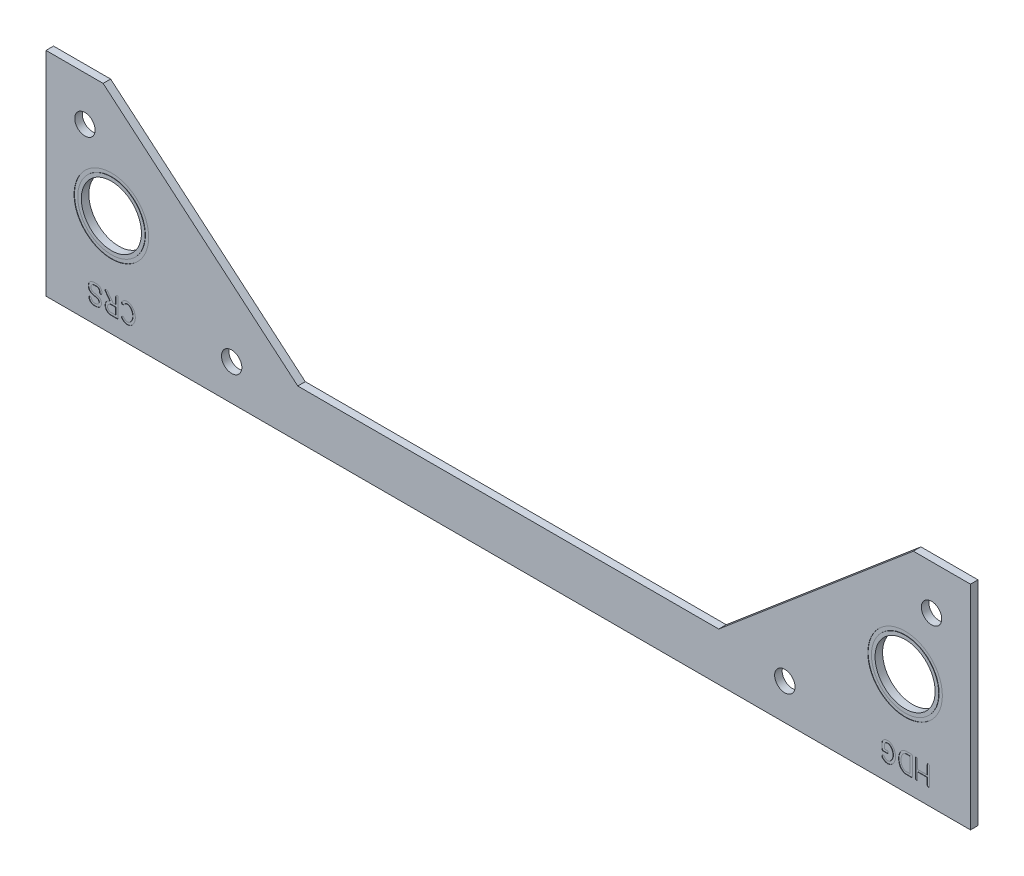
from build123d import *

# Parameters (mm, degrees)
SKETCH1_R             = 6.35
BOSS_EXTRUDE1_DEPTH   = 1.5875
F_6_CLEARANCE_HOLE1_D = 4.3053
WRAP1_START           = -0.0762
WRAP1_OUTLINE_R       = 7.874
WRAP1_OUTLINE_R_2     = 7.112
WRAP1_DEPTH           = 0.0762


# Read off the part's stored shape, not the designer's step: Wrap1
with BuildPart() as part:
    # Sketch1 → Boss-Extrude1 (new body)
    with BuildSketch(Plane.XY):
        Polygon((44.45, 10.16), (-44.45, 10.16), (-85.56625, 44.958), (-97.63125, 44.958), (-97.63125, 0), (97.63125, 0), (97.63125, 44.958), (85.56625, 44.958), align=None)
        with Locations((83.82, 21.59)):
            Circle(SKETCH1_R, mode=Mode.SUBTRACT)
        with Locations((-83.82, 21.59)):
            Circle(SKETCH1_R, mode=Mode.SUBTRACT)
    extrude(amount=BOSS_EXTRUDE1_DEPTH)

    # #6 Clearance Hole1 (through all)
    with Locations(Plane.XY.offset(1.5875)):
        with Locations((89.408, 35.56), (58.42, 7.62), (-58.42, 7.62), (-89.408, 35.56)):
            Hole(F_6_CLEARANCE_HOLE1_D / 2)

    # Wrap1 outline → Wrap1 (cut)
    # profile 1 of 8: a face of its own
    with BuildSketch(Plane.XY.offset(1.5875).offset(WRAP1_START)):
        with BuildLine():
            Line((88.493981083, 5.022523668), (88.493981083, 3.662843534))
            add(Edge.make_bspline(
                [(88.493981083, 3.662843534), (88.494987813, 3.639393258), (88.496867923, 3.595598926), (88.507456104, 3.534012781), (88.526617558, 3.481968162), (88.552883917, 3.43915638), (88.585909582, 3.404738694), (88.628294415, 3.383156015), (88.676480379, 3.368201286), (88.711228839, 3.367565991), (88.72952756, 3.367231442)],
                knots=[0, 0, 0, 0, 0.163145575, 0.304680914, 0.432746764, 0.546234711, 0.652222763, 0.75954351, 0.873374351, 1, 1, 1, 1], degree=3))
            add(Edge.make_bspline(
                [(88.72952756, 3.367231442), (88.755503069, 3.369576798), (88.804157081, 3.373969819), (88.868278836, 3.405621977), (88.91932179, 3.452839462), (88.937273236, 3.494979252), (88.946599804, 3.516872733)],
                knots=[0, 0, 0, 0, 0.27584322, 0.516674352, 0.748890989, 1, 1, 1, 1], degree=3))
            add(Edge.make_bspline(
                [(88.946599804, 3.516872733), (88.949336083, 3.5269797), (88.9546711, 3.546685598), (88.958302802, 3.579911349), (88.960092807, 3.622765923), (88.95974373, 3.655733197), (88.959531768, 3.675751142)],
                knots=[0, 0, 0, 0, 0.195990582, 0.382129514, 0.624824988, 1, 1, 1, 1], degree=3))
            Line((88.959531768, 3.675751142), (88.95953267, 7.324993192))
            add(Edge.make_bspline(
                [(88.95953267, 7.324993192), (88.95918669, 7.348233436), (88.958533812, 7.392088781), (88.94885352, 7.453762371), (88.930646455, 7.506258621), (88.904597811, 7.549320079), (88.870263693, 7.582154874), (88.827583902, 7.603849776), (88.777602822, 7.615788273), (88.741910974, 7.61612652), (88.723061579, 7.616305153)],
                knots=[0, 0, 0, 0, 0.160622086, 0.30310081, 0.42972381, 0.542581808, 0.648024553, 0.753746446, 0.869949841, 1, 1, 1, 1], degree=3))
            add(Edge.make_bspline(
                [(88.723061579, 7.616305153), (88.704820149, 7.616142616), (88.670327497, 7.615835274), (88.621934587, 7.603664824), (88.580405623, 7.582126109), (88.547041365, 7.549220773), (88.521901496, 7.506165239), (88.504911377, 7.453581951), (88.49486838, 7.391920949), (88.494289203, 7.347855101), (88.493981083, 7.324412264)],
                knots=[0, 0, 0, 0, 0.12736039, 0.240825295, 0.345955519, 0.451152037, 0.56428877, 0.691776822, 0.83602662, 1, 1, 1, 1], degree=3))
            Line((88.493981083, 7.324412264), (88.493981083, 5.488074353))
            Line((88.493981083, 5.488074353), (86.476596586, 5.488074353))
            Line((86.476596586, 5.488074353), (86.476596586, 7.299212254))
            add(Edge.make_bspline(
                [(86.476596586, 7.299212254), (86.476801176, 7.320855161), (86.477131076, 7.355754109), (86.475521057, 7.399943215), (86.471713125, 7.432252573), (86.466396058, 7.450709891), (86.463662818, 7.46019788)],
                knots=[0, 0, 0, 0, 0.40021474, 0.645341831, 0.817687883, 1, 1, 1, 1], degree=3))
            add(Edge.make_bspline(
                [(86.463662818, 7.46019788), (86.455717889, 7.482947411), (86.440375022, 7.526880215), (86.390430657, 7.57794996), (86.323355878, 7.608319445), (86.273407959, 7.613515406), (86.246590574, 7.616305153)],
                knots=[0, 0, 0, 0, 0.248391864, 0.479682481, 0.72063791, 1, 1, 1, 1], degree=3))
            add(Edge.make_bspline(
                [(86.246590574, 7.616305153), (86.22710955, 7.615848934), (86.190413113, 7.614989552), (86.139241692, 7.601967429), (86.096207612, 7.579781057), (86.061902862, 7.546551497), (86.037939661, 7.501994404), (86.021792625, 7.446691261), (86.01183918, 7.379882915), (86.011322452, 7.331225562), (86.011044097, 7.305014318)],
                knots=[0, 0, 0, 0, 0.128787138, 0.242596536, 0.346643283, 0.446192541, 0.553991865, 0.677886867, 0.826480782, 1, 1, 1, 1], degree=3))
            Line((86.011044097, 7.305014318), (86.011044999, 3.662843534))
            add(Edge.make_bspline(
                [(86.011044999, 3.662843534), (86.011335566, 3.639082207), (86.011878349, 3.594695789), (86.02198957, 3.532739659), (86.038915245, 3.480098796), (86.064372658, 3.437038609), (86.097355569, 3.403294735), (86.138896877, 3.380859229), (86.187253717, 3.367437418), (86.221863205, 3.367302585), (86.240124592, 3.367231442)],
                knots=[0, 0, 0, 0, 0.165306564, 0.308794471, 0.435609162, 0.548148335, 0.654294619, 0.759897952, 0.873312296, 1, 1, 1, 1], degree=3))
            add(Edge.make_bspline(
                [(86.240124592, 3.367231442), (86.258083995, 3.368390808), (86.292416785, 3.370607155), (86.341247792, 3.384951148), (86.384520164, 3.40836767), (86.421630892, 3.440743386), (86.450482096, 3.48098406), (86.470352855, 3.527219428), (86.479784749, 3.579656002), (86.477694193, 3.615996546), (86.476594781, 3.635107828)],
                knots=[0, 0, 0, 0, 0.132159831, 0.252648468, 0.371311252, 0.49177857, 0.611925638, 0.73275488, 0.859457334, 1, 1, 1, 1], degree=3))
            Line((86.476594781, 3.635107828), (86.476596586, 3.648886828))
            Line((86.476596586, 3.648886828), (86.476596586, 5.022523668))
            Line((86.476596586, 5.022523668), (88.493981083, 5.022523668))
        make_face()
    # profile 2 of 8: a face of its own
    with BuildSketch(Plane.XY.offset(1.5875).offset(WRAP1_START)):
        with BuildLine():
            Line((85.353361383, 3.697920222), (85.353362285, 7.230684394))
            add(Edge.make_bspline(
                [(85.353362285, 7.230684394), (85.3545604, 7.264093762), (85.356781915, 7.326040592), (85.347179224, 7.411307582), (85.327710237, 7.480685172), (85.296571398, 7.536192822), (85.248190749, 7.574600943), (85.187075686, 7.60167111), (85.110395914, 7.615402409), (85.054738858, 7.615987487), (85.024520026, 7.616305153)],
                knots=[0, 0, 0, 0, 0.165632283, 0.307111316, 0.423529841, 0.521468483, 0.616874736, 0.724163315, 0.850235297, 1, 1, 1, 1], degree=3))
            Line((85.024520026, 7.616305153), (84.123487997, 7.616305153))
            add(Edge.make_bspline(
                [(84.123487997, 7.616305153), (84.085723384, 7.615974995), (84.011450371, 7.61532566), (83.902187558, 7.604185509), (83.796477636, 7.589251531), (83.694536528, 7.566050622), (83.596513025, 7.535317044), (83.502178394, 7.49865168), (83.41198541, 7.454568656), (83.324812695, 7.404946699), (83.241467999, 7.347367278), (83.161698018, 7.282260052), (83.085295561, 7.209925308), (83.010388861, 7.131085021), (82.94011117, 7.04346273), (82.87241474, 6.948705427), (82.807523343, 6.847014503), (82.767819086, 6.775334411), (82.747570744, 6.738779061)],
                knots=[0, 0, 0, 0, 0.065536979, 0.128893921, 0.190512845, 0.250819081, 0.310169911, 0.368742757, 0.426366175, 0.48432095, 0.542747229, 0.602028193, 0.662919254, 0.725321696, 0.790696744, 0.857752969, 0.927456984, 1, 1, 1, 1], degree=3))
            add(Edge.make_bspline(
                [(82.747570744, 6.738779061), (82.72210879, 6.691143727), (82.67191226, 6.597233867), (82.612033876, 6.451618265), (82.561195258, 6.307296571), (82.52265572, 6.160244767), (82.494957674, 6.006094569), (82.475867814, 5.839812914), (82.464841435, 5.659113454), (82.464281367, 5.533659078), (82.463991259, 5.468675506)],
                knots=[0, 0, 0, 0, 0.122913588, 0.242315879, 0.35805373, 0.471138686, 0.588025999, 0.714382504, 0.852054224, 1, 1, 1, 1], degree=3))
            add(Edge.make_bspline(
                [(82.463991259, 5.468675506), (82.465302542, 5.380842764), (82.467844329, 5.210588137), (82.495523939, 4.963840057), (82.538470536, 4.733705836), (82.602766193, 4.520131218), (82.686402292, 4.32062847), (82.792245393, 4.134293881), (82.916207161, 3.956864888), (83.015326832, 3.851056116), (83.06532756, 3.797681083)],
                knots=[0, 0, 0, 0, 0.144255314, 0.279623914, 0.407417215, 0.52841464, 0.645397317, 0.76205245, 0.879967813, 1, 1, 1, 1], degree=3))
            add(Edge.make_bspline(
                [(83.06532756, 3.797681083), (83.101523538, 3.762631546), (83.172838141, 3.693575702), (83.291847306, 3.606042315), (83.415504087, 3.530170307), (83.547292261, 3.470106645), (83.684923978, 3.422837271), (83.829455975, 3.389539178), (83.980469551, 3.369686906), (84.083504755, 3.368059271), (84.135909393, 3.367231442)],
                knots=[0, 0, 0, 0, 0.127213436, 0.250640432, 0.372494573, 0.493323024, 0.61588337, 0.739719411, 0.867618933, 1, 1, 1, 1], degree=3))
            Line((84.135909393, 3.367231442), (85.011993089, 3.367232344))
            add(Edge.make_bspline(
                [(85.011993089, 3.367232344), (85.039625636, 3.367658373), (85.091740201, 3.368461857), (85.164699604, 3.381769992), (85.226661201, 3.406508191), (85.276739754, 3.443754895), (85.314435492, 3.49246366), (85.340766703, 3.551558899), (85.354373874, 3.621566259), (85.35371322, 3.671387492), (85.353361383, 3.697920222)],
                knots=[0, 0, 0, 0, 0.149708022, 0.282347061, 0.399882572, 0.508426231, 0.616661161, 0.730263632, 0.85634956, 1, 1, 1, 1], degree=3))
        make_face()
        with BuildLine():
            Line((84.828693151, 3.891901478), (84.117077041, 3.891901478))
            add(Edge.make_bspline(
                [(84.117077041, 3.891901478), (84.093176322, 3.89165555), (84.048314625, 3.891193943), (83.984658833, 3.894220744), (83.92856519, 3.898677046), (83.862794964, 3.906710463), (83.785567288, 3.927425549), (83.728786674, 3.954700322), (83.699917482, 3.968567743)],
                knots=[0, 0, 0, 0, 0.1670384, 0.313531406, 0.445256836, 0.560314845, 0.776449144, 1, 1, 1, 1], degree=3))
            add(Edge.make_bspline(
                [(83.699917482, 3.968567743), (83.668954285, 3.985033724), (83.605486619, 4.018785324), (83.517402269, 4.085592148), (83.431767476, 4.164095763), (83.34963399, 4.253553057), (83.273265842, 4.353262972), (83.204288354, 4.460241534), (83.142615016, 4.573510163), (83.108443691, 4.652751055), (83.091191487, 4.692757697)],
                knots=[0, 0, 0, 0, 0.10881488, 0.2230463, 0.342230135, 0.46952392, 0.599834168, 0.731985659, 0.864686609, 1, 1, 1, 1], degree=3))
            add(Edge.make_bspline(
                [(83.091191487, 4.692757697), (83.079636741, 4.720605978), (83.057065839, 4.775004474), (83.03209217, 4.856885852), (83.011634092, 4.935263395), (83.001330067, 5.000716287), (82.99649529, 5.056646032), (82.994080706, 5.106883182), (82.991049088, 5.165670968), (82.989319405, 5.233427944), (82.988713096, 5.310105324), (82.987482652, 5.395698718), (82.987600288, 5.490231637), (82.988295589, 5.556120763), (82.988659491, 5.590605447)],
                knots=[0, 0, 0, 0, 0.09913642, 0.193651885, 0.281364538, 0.365469695, 0.411235383, 0.466022875, 0.530927414, 0.604905703, 0.688992556, 0.783208964, 0.886537115, 1, 1, 1, 1], degree=3))
            add(Edge.make_bspline(
                [(82.988659491, 5.590605447), (82.988726823, 5.623242637), (82.988850689, 5.68328275), (82.988092813, 5.764585309), (82.990105475, 5.82926206), (82.993423481, 5.894427719), (83.003271336, 5.969957702), (83.018440053, 6.027977254), (83.02653167, 6.058927267)],
                knots=[0, 0, 0, 0, 0.207548397, 0.381810731, 0.516969731, 0.618955228, 0.796735068, 1, 1, 1, 1], degree=3))
            add(Edge.make_bspline(
                [(83.02653167, 6.058927267), (83.03686155, 6.100415597), (83.057387646, 6.182855417), (83.101264632, 6.301574505), (83.149335436, 6.417224511), (83.207976847, 6.526255311), (83.272179059, 6.630302097), (83.34415557, 6.725884788), (83.422081656, 6.813958311), (83.479282449, 6.866122114), (83.507785453, 6.892115199)],
                knots=[0, 0, 0, 0, 0.131076488, 0.260456909, 0.38784931, 0.515048918, 0.639818842, 0.76262785, 0.881718084, 1, 1, 1, 1], degree=3))
            add(Edge.make_bspline(
                [(83.507785453, 6.892115199), (83.528131017, 6.909399222), (83.568071818, 6.943329849), (83.631858033, 6.987441728), (83.699296598, 7.021478677), (83.769638204, 7.049251863), (83.846489459, 7.06801953), (83.930575585, 7.083539387), (84.024050728, 7.089753103), (84.089106719, 7.090991936), (84.12297743, 7.091636921)],
                knots=[0, 0, 0, 0, 0.12056717, 0.236687927, 0.349281488, 0.461125135, 0.577512149, 0.706024867, 0.846944969, 1, 1, 1, 1], degree=3))
            Line((84.12297743, 7.091636921), (84.828693151, 7.091636921))
            Line((84.828693151, 7.091636921), (84.828693151, 3.891901478))
        make_face(mode=Mode.SUBTRACT)
    # profile 3 of 8: a face of its own
    with BuildSketch(Plane.XY.offset(1.5875).offset(WRAP1_START)):
        with BuildLine():
            Line((79.441607556, 5.724544542), (79.441607556, 6.388713083))
            add(Edge.make_bspline(
                [(79.441607556, 6.388713083), (79.442031371, 6.428777651), (79.44279354, 6.500827914), (79.454733864, 6.600308769), (79.47603122, 6.685848735), (79.49930473, 6.736612908), (79.510885029, 6.761871853)],
                knots=[0, 0, 0, 0, 0.313430195, 0.56365834, 0.78288763, 1, 1, 1, 1], degree=3))
            add(Edge.make_bspline(
                [(79.510885029, 6.761871853), (79.525494122, 6.78705268), (79.55438024, 6.83684197), (79.611300463, 6.901603848), (79.675235667, 6.959065135), (79.748758044, 7.005485865), (79.828390303, 7.044209707), (79.914835027, 7.070263392), (80.006240231, 7.087599119), (80.069032759, 7.09027091), (80.101136791, 7.091636921)],
                knots=[0, 0, 0, 0, 0.122641954, 0.242496226, 0.362223526, 0.484465207, 0.608320686, 0.734962512, 0.864493876, 1, 1, 1, 1], degree=3))
            add(Edge.make_bspline(
                [(80.101136791, 7.091636921), (80.135374529, 7.090892778), (80.203300668, 7.089416431), (80.303139229, 7.073272506), (80.399709482, 7.046427647), (80.492207091, 7.007135189), (80.581784375, 6.957097046), (80.666750304, 6.894091569), (80.749578143, 6.821627503), (80.7991323, 6.765536111), (80.824403033, 6.736931637)],
                knots=[0, 0, 0, 0, 0.123087433, 0.244199952, 0.362736785, 0.482887978, 0.604903977, 0.730980946, 0.862810527, 1, 1, 1, 1], degree=3))
            add(Edge.make_bspline(
                [(80.824403033, 6.736931637), (80.85838663, 6.693433293), (80.926724831, 6.60596172), (81.01676944, 6.463779202), (81.093921113, 6.310876278), (81.159878408, 6.150250789), (81.213608385, 5.985509826), (81.250995257, 5.819057458), (81.276717382, 5.653285672), (81.280004363, 5.542358725), (81.281640313, 5.487149739)],
                knots=[0, 0, 0, 0, 0.122105124, 0.245543303, 0.371702871, 0.500643429, 0.629502944, 0.754629679, 0.877877766, 1, 1, 1, 1], degree=3))
            add(Edge.make_bspline(
                [(81.281640313, 5.487149739), (81.280502322, 5.44184457), (81.278227393, 5.351276114), (81.262106091, 5.216611997), (81.236058141, 5.08357133), (81.200306423, 4.953240623), (81.155097084, 4.827003388), (81.101528874, 4.705858504), (81.037692122, 4.591115059), (80.988460005, 4.519049856), (80.963883496, 4.483075147)],
                knots=[0, 0, 0, 0, 0.127017124, 0.253916831, 0.379719298, 0.506853733, 0.632469429, 0.755367784, 0.877880415, 1, 1, 1, 1], degree=3))
            add(Edge.make_bspline(
                [(80.963883496, 4.483075147), (80.934581712, 4.436291683), (80.878156042, 4.346202008), (80.782472646, 4.225484568), (80.682571517, 4.12278701), (80.577511211, 4.038220333), (80.466944329, 3.973044888), (80.351662929, 3.925906669), (80.23124935, 3.897115622), (80.149016593, 3.893646688), (80.107602772, 3.891899674)],
                knots=[0, 0, 0, 0, 0.15167662, 0.292079647, 0.42257614, 0.544865842, 0.661738228, 0.774134759, 0.88625041, 1, 1, 1, 1], degree=3))
            add(Edge.make_bspline(
                [(80.107602772, 3.891899674), (80.076720375, 3.892850809), (80.015670053, 3.894731075), (79.925915392, 3.913271685), (79.839405069, 3.942360749), (79.756449221, 3.986456473), (79.675246899, 4.043970601), (79.594370683, 4.11564091), (79.512197625, 4.201065032), (79.461631809, 4.26610577), (79.435140672, 4.300180235)],
                knots=[0, 0, 0, 0, 0.113034475, 0.223453864, 0.334425296, 0.446464253, 0.566352764, 0.698288518, 0.841935104, 1, 1, 1, 1], degree=3))
            add(Edge.make_bspline(
                [(79.435140672, 4.300180235), (79.421702088, 4.317509051), (79.396617702, 4.349854923), (79.360348089, 4.393342611), (79.32695761, 4.427116503), (79.288376648, 4.459003012), (79.238031373, 4.486827928), (79.194436601, 4.489258757), (79.172806556, 4.49046484)],
                knots=[0, 0, 0, 0, 0.194944981, 0.363883205, 0.503243782, 0.616105563, 0.809526383, 1, 1, 1, 1], degree=3))
            add(Edge.make_bspline(
                [(79.172806556, 4.49046484), (79.155392688, 4.488805282), (79.121225042, 4.485549071), (79.072619139, 4.4666167), (79.02777616, 4.438812721), (78.988399128, 4.400634148), (78.955744376, 4.355757467), (78.929727229, 4.306300528), (78.915047181, 4.251394619), (78.91202363, 4.213430398), (78.91047244, 4.193953392)],
                knots=[0, 0, 0, 0, 0.120141663, 0.235729244, 0.355945972, 0.482130469, 0.611265293, 0.737592694, 0.865375651, 1, 1, 1, 1], degree=3))
            add(Edge.make_bspline(
                [(78.91047244, 4.193953392), (78.91226134, 4.168148121), (78.915973704, 4.114596452), (78.94235804, 4.049437956), (78.974391934, 3.996137608), (79.006637263, 3.950783862), (79.045953623, 3.900133387), (79.075636218, 3.865887256), (79.091519928, 3.847561513)],
                knots=[0, 0, 0, 0, 0.193167382, 0.40086521, 0.518955138, 0.659977964, 0.818047872, 1, 1, 1, 1], degree=3))
            add(Edge.make_bspline(
                [(79.091519928, 3.847561513), (79.129953932, 3.809265341), (79.204858319, 3.734629576), (79.326079512, 3.637260768), (79.450297599, 3.553973257), (79.578778103, 3.486879452), (79.710311627, 3.433004164), (79.845786437, 3.395466254), (79.98480068, 3.371190004), (80.078867811, 3.368554243), (80.126077006, 3.367231442)],
                knots=[0, 0, 0, 0, 0.138655538, 0.270227067, 0.396882054, 0.5204978, 0.640241631, 0.759640695, 0.879371582, 1, 1, 1, 1], degree=3))
            add(Edge.make_bspline(
                [(80.126077006, 3.367231442), (80.161535569, 3.368104813), (80.233024783, 3.369865648), (80.339430415, 3.384702861), (80.446135679, 3.405595721), (80.551263056, 3.436249856), (80.654103263, 3.473737753), (80.752559768, 3.518011995), (80.845425639, 3.569920969), (80.903512691, 3.609720076), (80.932477299, 3.629565558)],
                knots=[0, 0, 0, 0, 0.123474493, 0.248941123, 0.373690374, 0.502026764, 0.629963554, 0.754781963, 0.877724135, 1, 1, 1, 1], degree=3))
            add(Edge.make_bspline(
                [(80.932477299, 3.629565558), (80.965479307, 3.656550786), (81.031706519, 3.710703749), (81.124561191, 3.799621057), (81.212553366, 3.8939167), (81.294866423, 3.993905849), (81.371675256, 4.09939238), (81.4429958, 4.210870879), (81.509430404, 4.327972027), (81.570106178, 4.450426834), (81.62434745, 4.576247924), (81.671298862, 4.704067489), (81.71242493, 4.832706176), (81.745725895, 4.963178871), (81.771249116, 5.095273966), (81.790969472, 5.228672029), (81.803238342, 5.363454897), (81.805283966, 5.453871553), (81.806308545, 5.499157991)],
                knots=[0, 0, 0, 0, 0.059978086, 0.120361813, 0.180764197, 0.241408588, 0.302515685, 0.364301227, 0.427564425, 0.491904847, 0.556543732, 0.620297763, 0.683477795, 0.746538826, 0.809683181, 0.872744213, 0.936262171, 1, 1, 1, 1], degree=3))
            add(Edge.make_bspline(
                [(81.806308545, 5.499157991), (81.804328977, 5.565740667), (81.800365654, 5.699046851), (81.774586015, 5.89766311), (81.733908465, 6.094770501), (81.676963421, 6.288881673), (81.603712423, 6.477506168), (81.518194396, 6.659411286), (81.417061878, 6.832343482), (81.339177898, 6.940433672), (81.300114547, 6.994647195)],
                knots=[0, 0, 0, 0, 0.124376918, 0.24901691, 0.373558647, 0.500057536, 0.626426892, 0.751214123, 0.875219398, 1, 1, 1, 1], degree=3))
            add(Edge.make_bspline(
                [(81.300114547, 6.994647195), (81.259879703, 7.044215716), (81.181598949, 7.140656035), (81.049740173, 7.266771355), (80.913030859, 7.3746917), (80.77020469, 7.46355428), (80.620651093, 7.531416978), (80.465816163, 7.580986396), (80.304214517, 7.61016805), (80.194547688, 7.614241985), (80.139008969, 7.616305153)],
                knots=[0, 0, 0, 0, 0.140053996, 0.272488503, 0.399610813, 0.521934798, 0.64082569, 0.759271769, 0.878087681, 1, 1, 1, 1], degree=3))
            add(Edge.make_bspline(
                [(80.139008969, 7.616305153), (80.085289444, 7.614318934), (79.978932249, 7.610386496), (79.822373902, 7.579864438), (79.670024768, 7.535097878), (79.524046751, 7.472137145), (79.3871071, 7.395516193), (79.263001183, 7.305102848), (79.152546827, 7.202454289), (79.090873595, 7.124200464), (79.060113731, 7.085170939)],
                knots=[0, 0, 0, 0, 0.129324271, 0.256044085, 0.383006815, 0.511280207, 0.638156234, 0.760261192, 0.880428952, 1, 1, 1, 1], degree=3))
            add(Edge.make_bspline(
                [(79.060113731, 7.085170939), (79.036168422, 7.046504351), (78.989703737, 6.971473751), (78.952423853, 6.867354841), (78.931961052, 6.781889537), (78.923937471, 6.711819105), (78.916353004, 6.636099594), (78.916738254, 6.583311599), (78.916938421, 6.555884149)],
                knots=[0, 0, 0, 0, 0.244071475, 0.473608612, 0.590930531, 0.716257593, 0.852573848, 1, 1, 1, 1], degree=3))
            Line((78.916938421, 6.555884149), (78.916939323, 5.555905821))
            add(Edge.make_bspline(
                [(78.916939323, 5.555905821), (78.916732912, 5.524954475), (78.916351846, 5.467813506), (78.92750903, 5.388735811), (78.950244803, 5.324210847), (78.984517162, 5.272381751), (79.034430157, 5.235964666), (79.097127433, 5.211092222), (79.174211573, 5.199138098), (79.2297399, 5.199617373), (79.259635453, 5.199875408)],
                knots=[0, 0, 0, 0, 0.158079594, 0.291839362, 0.405849866, 0.505375872, 0.60420274, 0.716418036, 0.847324058, 1, 1, 1, 1], degree=3))
            Line((79.259635453, 5.199875408), (79.879372019, 5.199875408))
            add(Edge.make_bspline(
                [(79.879372019, 5.199875408), (79.907106962, 5.199981711), (79.953662498, 5.200160151), (80.013453799, 5.20257746), (80.055941539, 5.210884443), (80.078157208, 5.220477095), (80.088204827, 5.224815623)],
                knots=[0, 0, 0, 0, 0.392293409, 0.658498923, 0.845547188, 1, 1, 1, 1], degree=3))
            add(Edge.make_bspline(
                [(80.088204827, 5.224815623), (80.11198587, 5.236346232), (80.159100311, 5.259190403), (80.21175832, 5.317742782), (80.247120396, 5.386677274), (80.251418543, 5.437176227), (80.253549217, 5.462209524)],
                knots=[0, 0, 0, 0, 0.256473684, 0.508119618, 0.756165489, 1, 1, 1, 1], degree=3))
            add(Edge.make_bspline(
                [(80.253549217, 5.462209524), (80.251366188, 5.484527668), (80.247140792, 5.527725909), (80.226076825, 5.588906945), (80.188310253, 5.640306266), (80.155667918, 5.666723499), (80.139008969, 5.680205479)],
                knots=[0, 0, 0, 0, 0.262673653, 0.508422212, 0.749124281, 1, 1, 1, 1], degree=3))
            add(Edge.make_bspline(
                [(80.139008969, 5.680205479), (80.127086056, 5.688690808), (80.10252488, 5.706170568), (80.063748054, 5.715942758), (80.027950546, 5.720324413), (79.99311683, 5.723360692), (79.95118288, 5.723503384), (79.920703178, 5.724180925), (79.904386204, 5.72454364)],
                knots=[0, 0, 0, 0, 0.178960546, 0.368658346, 0.483484291, 0.624321334, 0.798884543, 1, 1, 1, 1], degree=3))
            Line((79.904386204, 5.72454364), (79.441607556, 5.724544542))
        make_face()
    # profile 4 of 8: a face of its own
    with BuildSketch(Plane.XY.offset(1.5875).offset(WRAP1_START)):
        with BuildLine():
            add(Edge.make_bspline(
                [(-87.018826164, 3.387266243), (-86.979937425, 3.390357765), (-86.90327483, 3.39645218), (-86.791263591, 3.417546896), (-86.683923457, 3.445261436), (-86.583055125, 3.484103803), (-86.486584576, 3.528707351), (-86.397480337, 3.585047439), (-86.31234676, 3.647775462), (-86.234597246, 3.719830562), (-86.163275582, 3.797935011), (-86.101275095, 3.882297836), (-86.04832516, 3.971816985), (-86.00351442, 4.065846545), (-85.969870417, 4.165609838), (-85.943246849, 4.269504952), (-85.927986555, 4.378891267), (-85.924261399, 4.453475072), (-85.922367776, 4.491388552)],
                knots=[0, 0, 0, 0, 0.067837627, 0.133730448, 0.198062568, 0.260457926, 0.321570286, 0.382680298, 0.443545548, 0.505356171, 0.566805809, 0.627351865, 0.687170508, 0.747569405, 0.808229145, 0.870083873, 0.933959222, 1, 1, 1, 1], degree=3))
            add(Edge.make_bspline(
                [(-85.922367776, 4.491388552), (-85.924421734, 4.536439583), (-85.928515649, 4.626234523), (-85.952909748, 4.758796905), (-85.993275021, 4.887196785), (-86.047233938, 5.010511322), (-86.115290428, 5.125543269), (-86.195333251, 5.229636378), (-86.28583383, 5.322981388), (-86.355695524, 5.373279062), (-86.390689596, 5.398473418)],
                knots=[0, 0, 0, 0, 0.127450784, 0.254032707, 0.379917634, 0.50743089, 0.633940888, 0.75692129, 0.878240662, 1, 1, 1, 1], degree=3))
            add(Edge.make_bspline(
                [(-86.390689596, 5.398473418), (-86.421854114, 5.419184491), (-86.487306297, 5.462682193), (-86.601839713, 5.510237407), (-86.730772931, 5.55411839), (-86.823928396, 5.573194321), (-86.872867091, 5.583215753)],
                knots=[0, 0, 0, 0, 0.215334226, 0.45224813, 0.712241667, 1, 1, 1, 1], degree=3))
            Line((-86.872867091, 5.583215753), (-87.558850201, 5.730486426))
            add(Edge.make_bspline(
                [(-87.558850201, 5.730486426), (-87.584003321, 5.735166474), (-87.631129061, 5.7439348), (-87.695821328, 5.76247474), (-87.752000153, 5.778817796), (-87.784999745, 5.793494761), (-87.800273614, 5.800287997)],
                knots=[0, 0, 0, 0, 0.304444496, 0.570393348, 0.801156462, 1, 1, 1, 1], degree=3))
            add(Edge.make_bspline(
                [(-87.800273614, 5.800287997), (-87.826984665, 5.815503736), (-87.88015811, 5.845793567), (-87.950440175, 5.905527165), (-88.014058986, 5.973208492), (-88.06841503, 6.050538256), (-88.111184424, 6.135504153), (-88.144268008, 6.224508686), (-88.164039932, 6.31795031), (-88.167225426, 6.381520296), (-88.168834573, 6.413632551)],
                knots=[0, 0, 0, 0, 0.12260065, 0.244059996, 0.36680873, 0.493107322, 0.620218362, 0.745940299, 0.871662237, 1, 1, 1, 1], degree=3))
            add(Edge.make_bspline(
                [(-88.168834573, 6.413632551), (-88.166267428, 6.45256707), (-88.161216042, 6.529178747), (-88.134252383, 6.640599004), (-88.088704472, 6.74416317), (-88.029392818, 6.840028119), (-87.955632504, 6.923953127), (-87.871270524, 6.992979275), (-87.776766846, 7.045729784), (-87.708387218, 7.066386502), (-87.673725114, 7.076857534)],
                knots=[0, 0, 0, 0, 0.131496622, 0.25874666, 0.38438763, 0.511802964, 0.637684246, 0.759539767, 0.878109054, 1, 1, 1, 1], degree=3))
            add(Edge.make_bspline(
                [(-87.673725114, 7.076857534), (-87.654662643, 7.080139701), (-87.611164078, 7.087629263), (-87.542007005, 7.094424606), (-87.472173622, 7.101501572), (-87.426800192, 7.102347896), (-87.40677244, 7.102721461)],
                knots=[0, 0, 0, 0, 0.21608302, 0.493078829, 0.776245885, 1, 1, 1, 1], degree=3))
            Line((-87.40677244, 7.102721461), (-87.025179388, 7.103217595))
            add(Edge.make_bspline(
                [(-87.025179388, 7.103217595), (-86.998723677, 7.103003017), (-86.948812146, 7.102598191), (-86.878832313, 7.098148596), (-86.818111412, 7.090573619), (-86.781659925, 7.081196557), (-86.764792825, 7.076857534)],
                knots=[0, 0, 0, 0, 0.302265188, 0.570255645, 0.801145532, 1, 1, 1, 1], degree=3))
            add(Edge.make_bspline(
                [(-86.764792825, 7.076857534), (-86.73510887, 7.065794102), (-86.675978345, 7.043755714), (-86.594500779, 6.993509452), (-86.521378559, 6.929870261), (-86.456364365, 6.855642556), (-86.402031478, 6.773472199), (-86.362035754, 6.685911824), (-86.335799234, 6.595209145), (-86.331133034, 6.533266966), (-86.328800913, 6.502308871)],
                knots=[0, 0, 0, 0, 0.123908275, 0.246825646, 0.372593975, 0.502557912, 0.632404176, 0.757126356, 0.878614129, 1, 1, 1, 1], degree=3))
            add(Edge.make_bspline(
                [(-86.328800913, 6.502308871), (-86.329018383, 6.496142092), (-86.329696601, 6.476909919), (-86.333013534, 6.45793165), (-86.335266895, 6.445038748)],
                knots=[0, 0, 0, 0, 0.320649132, 1, 1, 1, 1], degree=3))
            Line((-86.335266895, 6.445038748), (-86.33519022, 6.394505224))
            add(Edge.make_bspline(
                [(-86.33519022, 6.394505224), (-86.333987325, 6.375551242), (-86.331694692, 6.339426272), (-86.318385661, 6.287540011), (-86.29637017, 6.241208903), (-86.265538824, 6.201220901), (-86.228391683, 6.168728083), (-86.186222583, 6.144120817), (-86.138911255, 6.128773218), (-86.105684893, 6.126566706), (-86.088635877, 6.125434508)],
                knots=[0, 0, 0, 0, 0.139958053, 0.266750316, 0.392807071, 0.516003708, 0.63680795, 0.754931163, 0.874250976, 1, 1, 1, 1], degree=3))
            add(Edge.make_bspline(
                [(-86.088635877, 6.125434508), (-86.06814493, 6.12697077), (-86.028061234, 6.129975954), (-85.971859267, 6.150084971), (-85.921787138, 6.181411967), (-85.880317485, 6.22565813), (-85.847269952, 6.280000425), (-85.822086186, 6.342284718), (-85.807312439, 6.413271662), (-85.805229161, 6.463133436), (-85.804132681, 6.489376908)],
                knots=[0, 0, 0, 0, 0.118909284, 0.232606296, 0.342759225, 0.459139682, 0.581234599, 0.71043286, 0.847593726, 1, 1, 1, 1], degree=3))
            add(Edge.make_bspline(
                [(-85.804132681, 6.489376908), (-85.807104145, 6.545614345), (-85.812961229, 6.656464581), (-85.850400232, 6.818638032), (-85.909737941, 6.97293058), (-85.991279481, 7.117416804), (-86.090594119, 7.249873767), (-86.207408015, 7.365011192), (-86.340564515, 7.461372495), (-86.438838558, 7.509035357), (-86.488603033, 7.533171102)],
                knots=[0, 0, 0, 0, 0.127880462, 0.252066598, 0.376650913, 0.502685102, 0.6281734, 0.751967999, 0.874400382, 1, 1, 1, 1], degree=3))
            add(Edge.make_bspline(
                [(-86.488603033, 7.533171102), (-86.528136859, 7.545296819), (-86.610596414, 7.570588609), (-86.741595303, 7.594850844), (-86.879201675, 7.612034248), (-86.97288261, 7.614881231), (-87.019737247, 7.616305153)],
                knots=[0, 0, 0, 0, 0.229738997, 0.479189018, 0.739515731, 1, 1, 1, 1], degree=3))
            Line((-87.019737247, 7.616305153), (-87.434150929, 7.616305153))
            add(Edge.make_bspline(
                [(-87.434150929, 7.616305153), (-87.479880987, 7.614208399), (-87.569384715, 7.610104592), (-87.700004166, 7.592695094), (-87.82344137, 7.564577785), (-87.940867418, 7.528307034), (-88.05057505, 7.479322931), (-88.15497325, 7.423548089), (-88.251608782, 7.356203334), (-88.34097254, 7.279715174), (-88.421847072, 7.195317453), (-88.493028885, 7.103861751), (-88.553002949, 7.005902574), (-88.602499009, 6.901214688), (-88.641193909, 6.789980833), (-88.669602958, 6.672109541), (-88.688743935, 6.547864362), (-88.691894719, 6.462660731), (-88.693502805, 6.419174821)],
                knots=[0, 0, 0, 0, 0.070604379, 0.138188217, 0.202953782, 0.265750532, 0.327439757, 0.388021697, 0.448108091, 0.508751457, 0.569227151, 0.628137868, 0.687203511, 0.746062496, 0.806456047, 0.868555415, 0.932913804, 1, 1, 1, 1], degree=3))
            add(Edge.make_bspline(
                [(-88.693502805, 6.419174821), (-88.692256959, 6.38157034), (-88.689797885, 6.307345882), (-88.675760425, 6.198252196), (-88.653350501, 6.093681836), (-88.624228969, 5.992845543), (-88.584625858, 5.896930734), (-88.539051772, 5.803782807), (-88.482925929, 5.716314986), (-88.420359514, 5.632839313), (-88.350025665, 5.555726035), (-88.274356981, 5.483910034), (-88.191389323, 5.420122418), (-88.102849968, 5.362709192), (-88.007990322, 5.312966583), (-87.907893906, 5.269089041), (-87.801426518, 5.233182701), (-87.72774796, 5.214765466), (-87.690351924, 5.205417678)],
                knots=[0, 0, 0, 0, 0.065995967, 0.130264126, 0.1926796, 0.253539267, 0.314139362, 0.374546463, 0.435254847, 0.496200792, 0.557404842, 0.61818051, 0.679025785, 0.74077118, 0.803128164, 0.866766407, 0.932376416, 1, 1, 1, 1], degree=3))
            Line((-87.690351924, 5.205417678), (-86.99967809, 5.064497523))
            add(Edge.make_bspline(
                [(-86.99967809, 5.064497523), (-86.977130912, 5.059365813), (-86.934264912, 5.049609565), (-86.873940225, 5.03699303), (-86.822321004, 5.021779435), (-86.791234872, 5.010932407), (-86.776801076, 5.005895956)],
                knots=[0, 0, 0, 0, 0.300763043, 0.571801407, 0.801180451, 1, 1, 1, 1], degree=3))
            add(Edge.make_bspline(
                [(-86.776801076, 5.005895956), (-86.752620573, 4.994055807), (-86.704879166, 4.970678901), (-86.641508446, 4.92183417), (-86.584186016, 4.86554503), (-86.536888336, 4.798776411), (-86.497951549, 4.725848057), (-86.469224006, 4.647904455), (-86.450878626, 4.565196242), (-86.448336343, 4.508420268), (-86.447036008, 4.4793803)],
                knots=[0, 0, 0, 0, 0.12276062, 0.242375628, 0.363773641, 0.488756426, 0.614662712, 0.740663334, 0.867353602, 1, 1, 1, 1], degree=3))
            add(Edge.make_bspline(
                [(-86.447036008, 4.4793803), (-86.44941188, 4.438796659), (-86.454009097, 4.360268967), (-86.487685775, 4.24874366), (-86.540611071, 4.148763904), (-86.614982276, 4.063832355), (-86.703932894, 3.992454583), (-86.808991724, 3.940653283), (-86.926818815, 3.905592003), (-87.010554378, 3.898396702), (-87.053914579, 3.894670809)],
                knots=[0, 0, 0, 0, 0.129639345, 0.250846854, 0.36936826, 0.488786334, 0.609364127, 0.731797594, 0.861118621, 1, 1, 1, 1], degree=3))
            Line((-87.053914579, 3.894670809), (-87.372831448, 3.888981503))
            Line((-87.372831448, 3.888981503), (-87.404755429, 3.888981503))
            add(Edge.make_bspline(
                [(-87.404755429, 3.888981503), (-87.44716494, 3.889966605), (-87.528503191, 3.891855957), (-87.643514844, 3.918982956), (-87.746657588, 3.959963921), (-87.835708845, 4.0205008), (-87.912024696, 4.097067742), (-87.975383259, 4.189909538), (-88.024719531, 4.299835159), (-88.045358791, 4.380149854), (-88.056141748, 4.422110176)],
                knots=[0, 0, 0, 0, 0.137472234, 0.263661397, 0.381624758, 0.496210213, 0.610800035, 0.730944547, 0.859432283, 1, 1, 1, 1], degree=3))
            add(Edge.make_bspline(
                [(-88.056141748, 4.422110176), (-88.061886494, 4.440119673), (-88.072824489, 4.474409752), (-88.094817289, 4.520932735), (-88.12121619, 4.559975155), (-88.151369353, 4.59153458), (-88.186014118, 4.615477347), (-88.224356609, 4.632655108), (-88.267338822, 4.64071376), (-88.296899807, 4.640311663), (-88.312009883, 4.640106132)],
                knots=[0, 0, 0, 0, 0.154020825, 0.293255627, 0.417897251, 0.536846803, 0.646878629, 0.759290409, 0.876961469, 1, 1, 1, 1], degree=3))
            add(Edge.make_bspline(
                [(-88.312009883, 4.640106132), (-88.330593223, 4.638992178), (-88.366533714, 4.636837772), (-88.417500429, 4.621591795), (-88.462899553, 4.597180969), (-88.501696475, 4.56359719), (-88.533743135, 4.522731753), (-88.555687139, 4.474506298), (-88.56996994, 4.42105882), (-88.572243237, 4.383409901), (-88.573420287, 4.363916341)],
                knots=[0, 0, 0, 0, 0.130879693, 0.253123515, 0.371609903, 0.49167618, 0.612368621, 0.734708751, 0.862639586, 1, 1, 1, 1], degree=3))
            add(Edge.make_bspline(
                [(-88.573420287, 4.363916341), (-88.57110586, 4.330489954), (-88.566102461, 4.258227751), (-88.534486008, 4.148047199), (-88.489621425, 4.032397724), (-88.447821867, 3.9582622), (-88.42655013, 3.920534736)],
                knots=[0, 0, 0, 0, 0.212562519, 0.459524264, 0.724952661, 1, 1, 1, 1], degree=3))
            add(Edge.make_bspline(
                [(-88.42655013, 3.920534736), (-88.399329979, 3.877854438), (-88.345800474, 3.793921942), (-88.247366383, 3.683303229), (-88.137355782, 3.588047709), (-88.016347524, 3.508903837), (-87.887317878, 3.445727474), (-87.751938685, 3.401763543), (-87.612182801, 3.372230845), (-87.516845846, 3.368909898), (-87.468661122, 3.367231442)],
                knots=[0, 0, 0, 0, 0.1310157, 0.257647564, 0.382103783, 0.507144384, 0.631334298, 0.753208409, 0.875267836, 1, 1, 1, 1], degree=3))
            Line((-87.468661122, 3.367231442), (-87.430294613, 3.367232344))
            Line((-87.430294613, 3.367232344), (-87.018826164, 3.387266243))
        make_face()
    # profile 5 of 8: a face of its own
    with BuildSketch(Plane.XY.offset(1.5875).offset(WRAP1_START)):
        with BuildLine():
            add(Edge.make_bspline(
                [(-84.115025752, 5.824042001), (-84.153528106, 5.815746459), (-84.229176381, 5.799447627), (-84.338470759, 5.766071617), (-84.441398485, 5.725428969), (-84.538354255, 5.67723921), (-84.628968267, 5.620522139), (-84.714190694, 5.556838754), (-84.793345485, 5.485360644), (-84.864874155, 5.406014811), (-84.92943721, 5.320842796), (-84.987455829, 5.231266451), (-85.035222316, 5.135995968), (-85.074195628, 5.035949109), (-85.105647264, 4.931602116), (-85.128854424, 4.822281102), (-85.142740842, 4.708195084), (-85.145199839, 4.630598645), (-85.146449967, 4.591149413)],
                knots=[0, 0, 0, 0, 0.067306555, 0.132241911, 0.195089406, 0.25629093, 0.317049495, 0.377579643, 0.437947091, 0.499058014, 0.559905429, 0.620499621, 0.681230821, 0.741733501, 0.803844927, 0.867332755, 0.932553336, 1, 1, 1, 1], degree=3))
            add(Edge.make_bspline(
                [(-85.146449967, 4.591149413), (-85.144446423, 4.546439955), (-85.140533483, 4.459122004), (-85.121846394, 4.331670152), (-85.092482237, 4.210908193), (-85.051432389, 4.09690624), (-85.000914751, 3.989043881), (-84.938277249, 3.888562309), (-84.864895821, 3.794723079), (-84.780906386, 3.708491638), (-84.688764018, 3.629762873), (-84.588411521, 3.561088373), (-84.480887446, 3.502845793), (-84.366693709, 3.454791203), (-84.245647462, 3.416191576), (-84.116993234, 3.390555782), (-83.981846688, 3.372154749), (-83.88934181, 3.368894169), (-83.84216908, 3.367231442)],
                knots=[0, 0, 0, 0, 0.066972661, 0.130798174, 0.192516203, 0.252737171, 0.311918725, 0.370508413, 0.429619903, 0.489932553, 0.550435175, 0.610788332, 0.67164119, 0.73320235, 0.79604133, 0.861499127, 0.929371679, 1, 1, 1, 1], degree=3))
            Line((-83.84216908, 3.367231442), (-82.760934795, 3.367232344))
            add(Edge.make_bspline(
                [(-82.760934795, 3.367232344), (-82.72901578, 3.366776263), (-82.669206005, 3.365921661), (-82.585786153, 3.380630567), (-82.514985618, 3.40710624), (-82.457332138, 3.447681633), (-82.414557827, 3.502431885), (-82.386534331, 3.569620996), (-82.373312682, 3.648759288), (-82.374619621, 3.704965764), (-82.375314938, 3.734868689)],
                knots=[0, 0, 0, 0, 0.152562747, 0.285871711, 0.403042079, 0.511865096, 0.618926373, 0.731199638, 0.856993042, 1, 1, 1, 1], degree=3))
            Line((-82.375314938, 3.734868689), (-82.375314036, 7.246272029))
            add(Edge.make_bspline(
                [(-82.375314036, 7.246272029), (-82.375186005, 7.271708337), (-82.374978903, 7.31285408), (-82.375977219, 7.364128847), (-82.37717644, 7.397864322), (-82.380388076, 7.415570488), (-82.38178092, 7.423249413)],
                knots=[0, 0, 0, 0, 0.430215932, 0.695916786, 0.868123225, 1, 1, 1, 1], degree=3))
            add(Edge.make_bspline(
                [(-82.38178092, 7.423249413), (-82.385169399, 7.437331598), (-82.391826073, 7.464996081), (-82.412418842, 7.502449729), (-82.437969585, 7.536243546), (-82.471277494, 7.563939116), (-82.508571464, 7.586822361), (-82.550023825, 7.603748445), (-82.594658762, 7.614073981), (-82.625585832, 7.615552045), (-82.641343901, 7.616305153)],
                knots=[0, 0, 0, 0, 0.123366308, 0.242353374, 0.36247188, 0.483882792, 0.610358729, 0.735566843, 0.865265096, 1, 1, 1, 1], degree=3))
            add(Edge.make_bspline(
                [(-82.641343901, 7.616305153), (-82.66175272, 7.616331482), (-82.700747288, 7.616381787), (-82.755532836, 7.601469067), (-82.801760396, 7.574459325), (-82.840203939, 7.53649363), (-82.867541445, 7.48514275), (-82.88788993, 7.423699665), (-82.898062854, 7.350602651), (-82.899315466, 7.298571934), (-82.89998317, 7.270836986)],
                knots=[0, 0, 0, 0, 0.122837245, 0.234701731, 0.338019873, 0.443194973, 0.556426239, 0.685774509, 0.832502255, 1, 1, 1, 1], degree=3))
            Line((-82.89998317, 7.270836986), (-82.89998317, 5.842779637))
            Line((-82.89998317, 5.842779637), (-83.465270361, 5.842779637))
            Line((-83.465270361, 5.842779637), (-84.653010226, 7.448564886))
            add(Edge.make_bspline(
                [(-84.653010226, 7.448564886), (-84.663018313, 7.461848685), (-84.681815713, 7.486798594), (-84.711522554, 7.519499163), (-84.740104336, 7.545316265), (-84.775805611, 7.572388745), (-84.82911842, 7.591666435), (-84.873488393, 7.593279548), (-84.897047815, 7.594136073)],
                knots=[0, 0, 0, 0, 0.167316355, 0.31425709, 0.443690142, 0.554630993, 0.763519441, 1, 1, 1, 1], degree=3))
            add(Edge.make_bspline(
                [(-84.897047815, 7.594136073), (-84.915622432, 7.592965492), (-84.951461068, 7.590706924), (-85.002460107, 7.576285011), (-85.048438751, 7.554126194), (-85.088478328, 7.523162632), (-85.121765985, 7.485681214), (-85.146181775, 7.441840504), (-85.162770876, 7.393303412), (-85.164806446, 7.358728686), (-85.165847913, 7.341039074)],
                knots=[0, 0, 0, 0, 0.135646111, 0.261721227, 0.384460861, 0.506393874, 0.629133508, 0.747998268, 0.871067295, 1, 1, 1, 1], degree=3))
            add(Edge.make_bspline(
                [(-85.165847913, 7.341039074), (-85.165125303, 7.326810486), (-85.163639532, 7.297554834), (-85.15135807, 7.253585849), (-85.128304831, 7.210414996), (-85.107486206, 7.184002396), (-85.096569537, 7.170152414)],
                knots=[0, 0, 0, 0, 0.226314244, 0.465328726, 0.719634264, 1, 1, 1, 1], degree=3))
            add(Edge.make_bspline(
                [(-85.096569537, 7.170152414), (-85.09060885, 7.164619925), (-85.080664233, 7.1553897), (-85.074213543, 7.14350669), (-85.071629322, 7.138746217)],
                knots=[0, 0, 0, 0, 0.599388267, 1, 1, 1, 1], degree=3))
            Line((-85.071629322, 7.138746217), (-84.115025752, 5.824042001))
        make_face()
        with BuildLine():
            Line((-82.89998317, 3.891901478), (-83.861621149, 3.891901478))
            add(Edge.make_bspline(
                [(-83.861621149, 3.891901478), (-83.898873527, 3.892270047), (-83.965540442, 3.89292964), (-84.057413157, 3.90119785), (-84.135892996, 3.920373167), (-84.182654083, 3.940780176), (-84.206111481, 3.951017221)],
                knots=[0, 0, 0, 0, 0.31672138, 0.566805091, 0.782690566, 1, 1, 1, 1], degree=3))
            add(Edge.make_bspline(
                [(-84.206111481, 3.951017221), (-84.236544892, 3.96640381), (-84.296658879, 3.996796367), (-84.37681246, 4.058702621), (-84.448343898, 4.129764124), (-84.509374012, 4.211255736), (-84.558049604, 4.300311928), (-84.593533436, 4.395168206), (-84.616606875, 4.4946163), (-84.620042841, 4.563004884), (-84.621781735, 4.597615395)],
                knots=[0, 0, 0, 0, 0.125937624, 0.248759913, 0.372828307, 0.498156311, 0.624093935, 0.747042986, 0.871981973, 1, 1, 1, 1], degree=3))
            add(Edge.make_bspline(
                [(-84.621781735, 4.597615395), (-84.620293853, 4.632206198), (-84.617371442, 4.700147426), (-84.596251848, 4.799304462), (-84.562805805, 4.893470264), (-84.516660006, 4.982196202), (-84.458594142, 5.063199404), (-84.390520303, 5.134914982), (-84.313221309, 5.197341977), (-84.255005436, 5.229064535), (-84.225509426, 5.24513728)],
                knots=[0, 0, 0, 0, 0.129766173, 0.254879106, 0.378796041, 0.503887621, 0.628963185, 0.751585361, 0.874136719, 1, 1, 1, 1], degree=3))
            add(Edge.make_bspline(
                [(-84.225509426, 5.24513728), (-84.198796448, 5.258119525), (-84.145159411, 5.2841866), (-84.071077689, 5.302351742), (-84.006682945, 5.310187734), (-83.950394198, 5.316545444), (-83.885884196, 5.317172431), (-83.840316736, 5.317786776), (-83.816305153, 5.318110502)],
                knots=[0, 0, 0, 0, 0.211517219, 0.424705819, 0.540004973, 0.674697536, 0.82858323, 1, 1, 1, 1], degree=3))
            Line((-83.816305153, 5.318110502), (-82.89998317, 5.318110502))
            Line((-82.89998317, 5.318110502), (-82.89998317, 3.891901478))
        make_face(mode=Mode.SUBTRACT)
    # profile 6 of 8: a face of its own
    with BuildSketch(Plane.XY.offset(1.5875).offset(WRAP1_START)):
        with BuildLine():
            add(Edge.make_bspline(
                [(-80.487769663, 3.367232344), (-80.4302223, 3.369360788), (-80.316787851, 3.373556271), (-80.149904283, 3.401603081), (-79.990520729, 3.449256942), (-79.837479306, 3.513942504), (-79.692650142, 3.598979312), (-79.555699022, 3.702471972), (-79.42465194, 3.823215063), (-79.346720728, 3.915623292), (-79.306744749, 3.963025473)],
                knots=[0, 0, 0, 0, 0.125937799, 0.248242216, 0.369135037, 0.489295058, 0.610996511, 0.735661781, 0.864403761, 1, 1, 1, 1], degree=3))
            add(Edge.make_bspline(
                [(-79.306744749, 3.963025473), (-79.265521734, 4.01845024), (-79.183375609, 4.12889655), (-79.076489893, 4.304755551), (-78.984717244, 4.487435687), (-78.908226036, 4.675574183), (-78.846893643, 4.867897965), (-78.802634379, 5.062830053), (-78.774642214, 5.259724349), (-78.770977846, 5.391608814), (-78.769144553, 5.457590965)],
                knots=[0, 0, 0, 0, 0.128110482, 0.255288942, 0.381247665, 0.507070276, 0.631739752, 0.755364191, 0.877608049, 1, 1, 1, 1], degree=3))
            add(Edge.make_bspline(
                [(-78.769144553, 5.457590965), (-78.770676688, 5.527260759), (-78.773723729, 5.665816944), (-78.800239413, 5.871336919), (-78.839135389, 6.073581477), (-78.895862622, 6.270785321), (-78.966832714, 6.461972551), (-79.051875066, 6.645383355), (-79.151288714, 6.820274434), (-79.22967073, 6.928507468), (-79.26887257, 6.982638943)],
                knots=[0, 0, 0, 0, 0.127967488, 0.254496047, 0.380212428, 0.506112006, 0.631068578, 0.754595203, 0.877263687, 1, 1, 1, 1], degree=3))
            add(Edge.make_bspline(
                [(-79.26887257, 6.982638943), (-79.309793692, 7.033052263), (-79.389571768, 7.131335924), (-79.522333862, 7.261231951), (-79.661723022, 7.371102896), (-79.807067674, 7.462053789), (-79.960658279, 7.530652243), (-80.119818885, 7.580853187), (-80.286231181, 7.611628424), (-80.399364674, 7.614730989), (-80.456765786, 7.616305153)],
                knots=[0, 0, 0, 0, 0.139240143, 0.271456653, 0.397547531, 0.5194744, 0.638345044, 0.757450466, 0.876936417, 1, 1, 1, 1], degree=3))
            add(Edge.make_bspline(
                [(-80.456765786, 7.616305153), (-80.505810645, 7.614553269), (-80.602854636, 7.611086853), (-80.745495333, 7.588150499), (-80.883017444, 7.552781729), (-81.014400489, 7.500579842), (-81.141410206, 7.436563753), (-81.261787683, 7.35592559), (-81.377328556, 7.262347944), (-81.447946763, 7.190872542), (-81.48393317, 7.154449315)],
                knots=[0, 0, 0, 0, 0.126861274, 0.251017629, 0.372938237, 0.493500655, 0.616054593, 0.74022117, 0.867619027, 1, 1, 1, 1], degree=3))
            add(Edge.make_bspline(
                [(-81.48393317, 7.154449315), (-81.502184578, 7.134512363), (-81.536064081, 7.097504037), (-81.582066213, 7.044807635), (-81.618155639, 6.997845388), (-81.652748602, 6.946148623), (-81.682130154, 6.886769313), (-81.686833493, 6.837919453), (-81.688997162, 6.81544713)],
                knots=[0, 0, 0, 0, 0.200338057, 0.371881128, 0.518403165, 0.638667511, 0.833776796, 1, 1, 1, 1], degree=3))
            add(Edge.make_bspline(
                [(-81.688997162, 6.81544713), (-81.687855318, 6.795952087), (-81.68568487, 6.758895424), (-81.67130362, 6.706159745), (-81.648401555, 6.659965612), (-81.617062216, 6.620279853), (-81.579391366, 6.587691196), (-81.535121859, 6.56437092), (-81.485706121, 6.550116693), (-81.451084738, 6.547831963), (-81.433129028, 6.546647032)],
                knots=[0, 0, 0, 0, 0.140889772, 0.267806797, 0.39225918, 0.511172113, 0.631184483, 0.749700794, 0.870187156, 1, 1, 1, 1], degree=3))
            add(Edge.make_bspline(
                [(-81.433129028, 6.546647032), (-81.408616435, 6.547467376), (-81.363084467, 6.54899116), (-81.298376412, 6.571768957), (-81.242817354, 6.615344834), (-81.212998718, 6.653910125), (-81.196658839, 6.675042955)],
                knots=[0, 0, 0, 0, 0.259798253, 0.482573418, 0.716462968, 1, 1, 1, 1], degree=3))
            add(Edge.make_bspline(
                [(-81.196658839, 6.675042955), (-81.170106844, 6.708453724), (-81.118750939, 6.773075621), (-81.035129915, 6.859529565), (-80.949799953, 6.932785695), (-80.861763877, 6.992052064), (-80.771532526, 7.037912919), (-80.67904034, 7.070342055), (-80.5841601, 7.090054933), (-80.52028718, 7.091107628), (-80.488171983, 7.091636921)],
                knots=[0, 0, 0, 0, 0.14979699, 0.289731908, 0.421672675, 0.544027598, 0.661532668, 0.776090511, 0.887418682, 1, 1, 1, 1], degree=3))
            add(Edge.make_bspline(
                [(-80.488171983, 7.091636921), (-80.45362284, 7.090918447), (-80.385381808, 7.089499326), (-80.284687633, 7.073045378), (-80.187542285, 7.046600939), (-80.093956821, 7.007996109), (-80.003968945, 6.958285494), (-79.919160054, 6.894975544), (-79.835699983, 6.82325965), (-79.785847657, 6.76741298), (-79.760287182, 6.738779061)],
                knots=[0, 0, 0, 0, 0.123723462, 0.244377028, 0.364590703, 0.483863586, 0.606380251, 0.731979454, 0.862579479, 1, 1, 1, 1], degree=3))
            add(Edge.make_bspline(
                [(-79.760287182, 6.738779061), (-79.724914272, 6.695092754), (-79.654310632, 6.607895739), (-79.563805162, 6.464600163), (-79.484172134, 6.313046107), (-79.41693655, 6.152985598), (-79.364352409, 5.987683642), (-79.323254666, 5.820690265), (-79.300389132, 5.652193099), (-79.295999165, 5.539553796), (-79.293812785, 5.483454892)],
                knots=[0, 0, 0, 0, 0.123415741, 0.246335413, 0.371613555, 0.499267544, 0.627206246, 0.752405818, 0.876688138, 1, 1, 1, 1], degree=3))
            add(Edge.make_bspline(
                [(-79.293812785, 5.483454892), (-79.296120714, 5.43012783), (-79.300657116, 5.325309573), (-79.320585647, 5.171301812), (-79.349755244, 5.023329956), (-79.389939275, 4.881071268), (-79.439242355, 4.744577889), (-79.499922485, 4.614372499), (-79.570350603, 4.490205094), (-79.649841718, 4.37294362), (-79.737078872, 4.265488529), (-79.82892707, 4.169875748), (-79.92609268, 4.088794926), (-80.026693782, 4.020331084), (-80.13306634, 3.967808546), (-80.242814264, 3.927421347), (-80.357373034, 3.90081666), (-80.435693678, 3.894891471), (-80.47524002, 3.891899674)],
                knots=[0, 0, 0, 0, 0.073667034, 0.144797966, 0.214162808, 0.281724766, 0.348698365, 0.414315793, 0.479805028, 0.545598485, 0.609667723, 0.670696014, 0.72833742, 0.784106462, 0.838289407, 0.891679404, 0.945305821, 1, 1, 1, 1], degree=3))
            add(Edge.make_bspline(
                [(-80.47524002, 3.891899674), (-80.506115245, 3.892916811), (-80.567396042, 3.894935614), (-80.657496176, 3.912620244), (-80.745376761, 3.938921989), (-80.829344139, 3.978447646), (-80.910628288, 4.02782145), (-80.988390308, 4.088549714), (-81.063728572, 4.159902018), (-81.109422192, 4.214107928), (-81.132922733, 4.241986399)],
                knots=[0, 0, 0, 0, 0.119887093, 0.237950542, 0.355673855, 0.475614692, 0.597527388, 0.724633345, 0.858377042, 1, 1, 1, 1], degree=3))
            add(Edge.make_bspline(
                [(-81.132922733, 4.241986399), (-81.146637451, 4.259645202), (-81.172130712, 4.292469828), (-81.209537017, 4.336465005), (-81.244812922, 4.369894768), (-81.286324042, 4.402674117), (-81.344662458, 4.429391924), (-81.394312389, 4.430677215), (-81.420197065, 4.431347293)],
                knots=[0, 0, 0, 0, 0.186172447, 0.346062021, 0.480252167, 0.589977796, 0.78623753, 1, 1, 1, 1], degree=3))
            add(Edge.make_bspline(
                [(-81.420197065, 4.431347293), (-81.438179026, 4.429908621), (-81.47329305, 4.427099276), (-81.52326304, 4.4107778), (-81.568498665, 4.385384343), (-81.607789166, 4.351251473), (-81.640460017, 4.310715729), (-81.663873137, 4.264084483), (-81.679218904, 4.212755209), (-81.681408348, 4.176514362), (-81.682531181, 4.157928637)],
                knots=[0, 0, 0, 0, 0.128484586, 0.250896472, 0.372017372, 0.496777527, 0.620427814, 0.741408863, 0.867384337, 1, 1, 1, 1], degree=3))
            add(Edge.make_bspline(
                [(-81.682531181, 4.157928637), (-81.681632437, 4.138381274), (-81.679848971, 4.099591533), (-81.659193699, 4.040722215), (-81.619634327, 3.980653689), (-81.586034645, 3.940455795), (-81.567067221, 3.917763601)],
                knots=[0, 0, 0, 0, 0.21400035, 0.424661788, 0.675214666, 1, 1, 1, 1], degree=3))
            add(Edge.make_bspline(
                [(-81.567067221, 3.917763601), (-81.527881651, 3.873825113), (-81.451512332, 3.788192765), (-81.325607694, 3.676656932), (-81.197522239, 3.579812342), (-81.063023275, 3.503502762), (-80.926078415, 3.440775993), (-80.783510086, 3.399068929), (-80.637337124, 3.37158556), (-80.538178535, 3.368691129), (-80.488171983, 3.367231442)],
                knots=[0, 0, 0, 0, 0.140986534, 0.274770673, 0.402439409, 0.525093587, 0.644679097, 0.762579171, 0.880266579, 1, 1, 1, 1], degree=3))
            Line((-80.488171983, 3.367231442), (-80.487769663, 3.367232344))
        make_face()
    # profile 7 of 8: a face of its own
    with BuildSketch(Plane.XY.offset(1.5875).offset(WRAP1_START)):
        with Locations((83.82, 21.59)):
            Circle(WRAP1_OUTLINE_R)
        with Locations((83.82, 21.59)):
            Circle(WRAP1_OUTLINE_R_2, mode=Mode.SUBTRACT)
    # profile 8 of 8: a face of its own
    with BuildSketch(Plane.XY.offset(1.5875).offset(WRAP1_START)):
        with Locations((-83.82, 21.59)):
            Circle(WRAP1_OUTLINE_R)
        with Locations((-83.82, 21.59)):
            Circle(WRAP1_OUTLINE_R_2, mode=Mode.SUBTRACT)
    extrude(amount=WRAP1_DEPTH, mode=Mode.SUBTRACT)


solid = part.part
